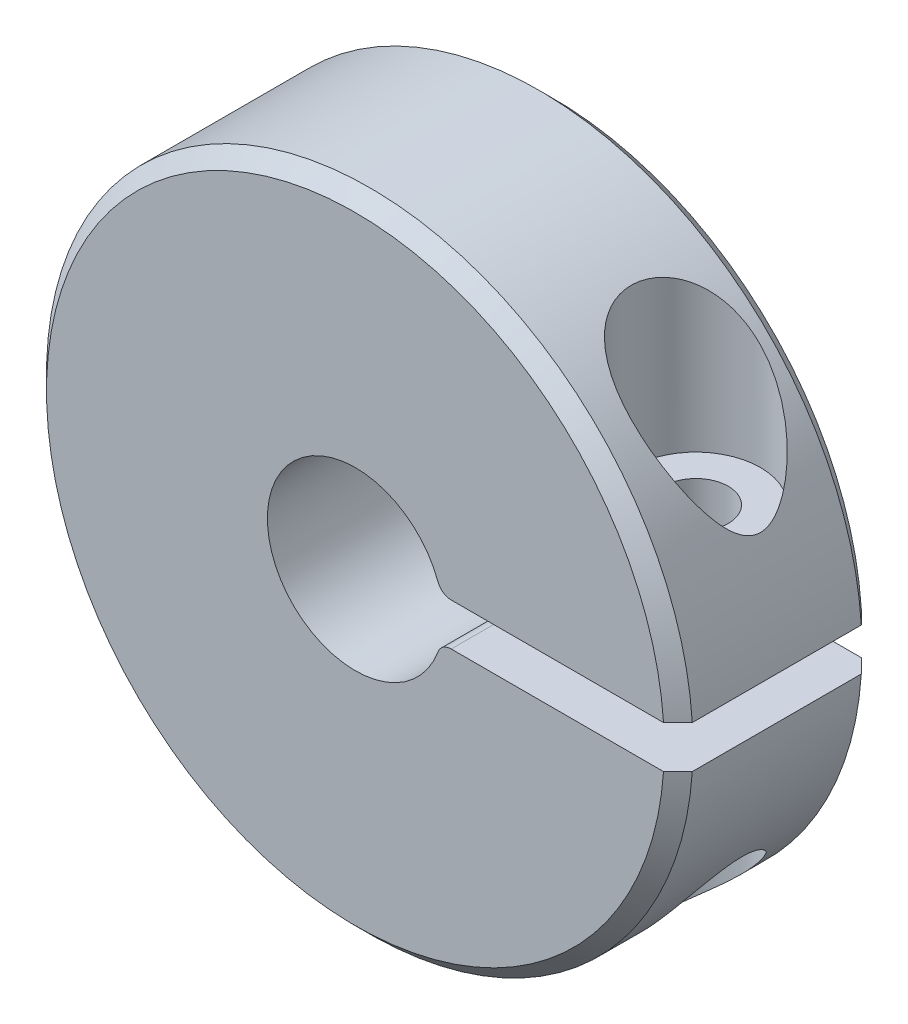
from build123d import *
from build123d.topology import SkipClean

# Parameters (mm, degrees)
BOSS_EXTRUDE1_DEPTH     = 6.985
CUT_EXTRUDE1_DEPTH      = 19.104903341
CUT_EXTRUDE1_DEPTH_BACK = 19.104903341
SKETCH2_R               = 1.143
SKETCH3_R               = 2.286
CUT_EXTRUDE2_DEPTH      = 21.568811653
BOSS_EXTRUDE2_START     = 1.27
BOSS_EXTRUDE2_DEPTH     = 1.27
BOSS_EXTRUDE3_START     = 2.54
SKETCH5_R               = 11.43
SKETCH5_R_2             = 3.1115
BOSS_EXTRUDE3_DEPTH     = 2.54
SKETCH29_R              = 1.778
CUT_EXTRUDE9_DEPTH      = 21.245185396
CHAMFER3_SIZE           = 2.881011164
CHAMFER3_SIZE_2         = 0.508
CHAMFER4_SIZE           = 0.508
FILLET1_R               = 0.5
SKETCH30_R              = 16.901185141
CUT_EXTRUDE10_DEPTH     = 3.81
CHAMFER5_SIZE           = 0.5


with BuildPart() as part:
    # Sketch1 → Boss-Extrude1 (new body)
    with BuildSketch(Plane.XY):
        with BuildLine():
            Line((3.019756985, -0.75), (11.405367158, -0.75))
            ThreePointArc((11.405367158, -0.75), (-11.43, 0), (11.405367158, 0.75))
            Line((11.405367158, 0.75), (3.019756985, 0.75))
            ThreePointArc((3.019756985, 0.75), (-3.1115, 0), (3.019756985, -0.75))
        make_face()
    extrude(amount=BOSS_EXTRUDE1_DEPTH)

    # Sketch2 → Cut-Extrude1 (cut, two sides: drawn at the far end of the back side and taken through both)
    with BuildSketch(Plane.XZ.offset(-0.75).offset(-CUT_EXTRUDE1_DEPTH_BACK)):
        with Locations(Location((8.230367158, 3.175, 0), (0, 0, 270))):
            Circle(SKETCH2_R)
    extrude(amount=CUT_EXTRUDE1_DEPTH + CUT_EXTRUDE1_DEPTH_BACK, mode=Mode.SUBTRACT)

    # Sketch3 → Cut-Extrude2 (cut, through all)
    with BuildSketch(Plane(origin=(0, 4.179, 0), x_dir=(-1, 0, 0), z_dir=(0, -1, 0))):
        with Locations(Location((-8.230367158, -3.175, 0), (0, 0, 90))):
            Circle(SKETCH3_R)
    extrude(amount=-CUT_EXTRUDE2_DEPTH, mode=Mode.SUBTRACT)

    # Sketch4 → Boss-Extrude2 (add)
    with BuildSketch(Plane(origin=(0, 0, 0), x_dir=(-1, 0, 0), z_dir=(0, 0, -1)).offset(BOSS_EXTRUDE2_START)):
        with BuildLine():
            Line((3.1115, 0), (11.43, 0))
            ThreePointArc((11.43, 0), (0.375202204, 11.42384013), (-11.405367158, 0.75))
            Line((-11.405367158, 0.75), (-3.019756985, 0.75))
            ThreePointArc((-3.019756985, 0.75), (0.377795176, 3.088479084), (3.1115, 0))
        make_face()
    extrude(amount=-BOSS_EXTRUDE2_DEPTH)

    # Sketch5 → Boss-Extrude3 (add)
    with SkipClean():  # the faces are left unmerged after this step: merging them gives an invalid solid
        with BuildSketch(Plane(origin=(0, 0, -1.27), x_dir=(-1, 0, 0), z_dir=(0, 0, -1)).offset(BOSS_EXTRUDE3_START)):
            Circle(SKETCH5_R)
            Circle(SKETCH5_R_2, mode=Mode.SUBTRACT)
        extrude(amount=-BOSS_EXTRUDE3_DEPTH)

    # Sketch29 → Cut-Extrude9 (cut, through all)
    with SkipClean():  # the faces are left unmerged after this step: merging them gives an invalid solid
        with BuildSketch(Plane(origin=(0, -3.75, 0), x_dir=(1, 0, 0), z_dir=(0, 1, 0))):
            with Locations(Location((8.230367158, -3.175, 0), (0, 0, 270))):
                Circle(SKETCH29_R)
        extrude(amount=-CUT_EXTRUDE9_DEPTH, mode=Mode.SUBTRACT)

    # Chamfer3
    # the kernel refuses this chamfer: 2.881011164, 0.508 mm, written as the material it adds along each edge
    with BuildSketch(Plane(origin=(8.230367158, -3.75, 3.175), x_dir=(0, 0, 1), z_dir=(-1, 0, 0))) as chamfer3_piece_1_section:
        Polygon((1.778, -CHAMFER3_SIZE), (1.778 - CHAMFER3_SIZE_2, 0), (1.778, 0), align=None)
    chamfer3_piece_1 = revolve(axis=Axis((8.230367158, -3.75, 3.175), (0, 1, 0)), mode=Mode.PRIVATE)
    chamfer3_piece_1 = chamfer3_piece_1 & Plane(origin=(0, 0, 1.63014176), x_dir=(0.9978448956793416, -0.06561679790026252, 0), z_dir=(0, 0, -1)) * Cylinder(11.43, 12, mode=Mode.PRIVATE)
    add(chamfer3_piece_1)

    # Chamfer4
    chamfer4_edges = [part.edges().sort_by_distance(p)[0] for p in [
        (-11.43, 0, 6.985),
    ]]
    chamfer(chamfer4_edges, length=CHAMFER4_SIZE)

    # Fillet1
    # the kernel refuses this fillet: 0.5 mm, written as the material it takes off along each edge
    with BuildSketch(Plane(origin=(-3.1115, 0, -1.27), x_dir=(-1, 0, 0), z_dir=(0, 0, 1))) as fillet1_piece_1:
        with BuildLine():
            CenterArc((0.46522088, -0.5), FILLET1_R, 90, 82.042030685)
            ThreePointArc((-0.029964068, -0.430776686), (-0.007500056, -0.215908776), (0, 0))
            Line((0, 0), (0.46522088, 0))
        make_face()
    extrude(amount=1.27, mode=Mode.SUBTRACT)
    with BuildSketch(Plane(origin=(-11.43, 0, -1.27), x_dir=(0.022878815711235678, 0.9997382456381528, 0), z_dir=(0, 0, 1))) as fillet1_piece_2:
        with BuildLine():
            CenterArc((0.511570319, -0.499869123), FILLET1_R, 88.689026033, 92.621947934)
            Line((0.011701196, -0.511308531), (0, 0))
            ThreePointArc((0, 0), (0.261504864, 0.002991852), (0.523009727, 0))
        make_face()
    extrude(amount=1.27, mode=Mode.SUBTRACT)
    with BuildSketch(Plane(origin=(3.019756985, -0.75, -0.921304177), x_dir=(1, 0, 0), z_dir=(0, 0, 1))) as fillet1_piece_3:
        with BuildLine():
            CenterArc((0.368521671, -0.5), FILLET1_R, 90, 69.75002962)
            ThreePointArc((-0.100574087, -0.326941714), (-0.04579087, -0.164853974), (0, 0))
            Line((0, 0), (0.368521671, 0))
        make_face()
    extrude(amount=8.827608353, mode=Mode.SUBTRACT)
    with BuildSketch(Plane(origin=(3.019756985, 0.75, 7.906304177), x_dir=(1, 0, 0), z_dir=(0, 0, -1))) as fillet1_piece_4:
        with BuildLine():
            CenterArc((0.368521671, -0.5), FILLET1_R, 90, 69.75002962)
            ThreePointArc((-0.100574087, -0.326941714), (-0.04579087, -0.164853974), (0, 0))
            Line((0, 0), (0.368521671, 0))
        make_face()
    extrude(amount=9.176304177, mode=Mode.SUBTRACT)

    # Sketch30 → Cut-Extrude10 (cut)
    with BuildSketch(Plane(origin=(0, 0, -3.81), x_dir=(-1, 0, 0), z_dir=(0, 0, -1))):
        Circle(SKETCH30_R)
    extrude(amount=-CUT_EXTRUDE10_DEPTH, mode=Mode.SUBTRACT)

    # Chamfer5
    chamfer5_edges = [part.edges().sort_by_distance(p)[0] for p in [
        (-11.43, 0, 0),
    ]]
    chamfer(chamfer5_edges, length=CHAMFER5_SIZE)


solid = part.part
